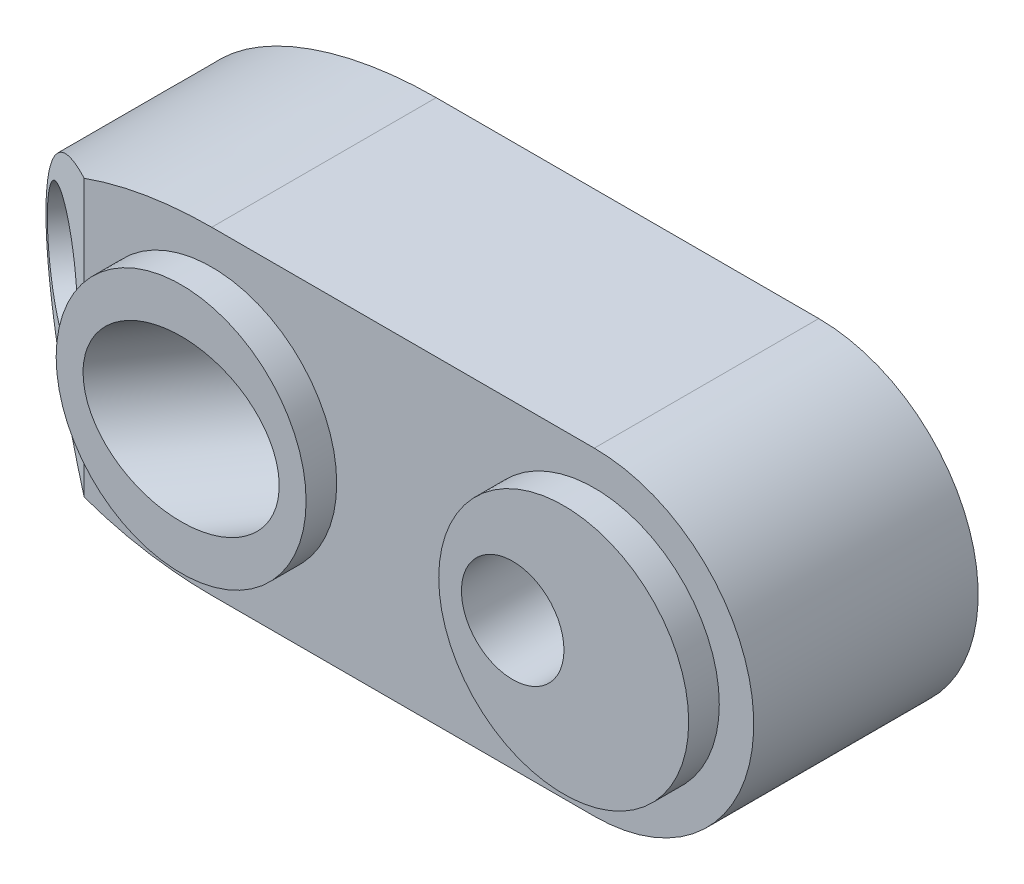
from build123d import *

# Parameters (mm, degrees)
BOSS_EXTRUDE1_DEPTH     = 12.7
SKETCH2_OUTSIDE_W       = 50.606
SKETCH2_OUTSIDE_H       = 26.794
SKETCH2_OUTSIDE_R       = 6.223
CUT_EXTRUDE1_DEPTH      = 1.524
CUT_EXTRUDE2_DEPTH      = 31.86452773
CUT_EXTRUDE2_DEPTH_BACK = 31.86452773
SKETCH3_R               = 4
SKETCH5_W               = 11
SKETCH5_H               = 21
CUT_EXTRUDE3_DEPTH      = 26.772703239
CUT_EXTRUDE4_DEPTH      = 31.86452773
CUT_EXTRUDE4_DEPTH_BACK = 31.86452773
F_1_4_20_TAPPED_HOLE1_D = 5.1054


with BuildPart() as part:
    # Sketch1 → Boss-Extrude1 (new body)
    with BuildSketch(Plane.XY):
        with BuildLine():
            Line((0, 7.9375), (19.05, 7.9375))
            ThreePointArc((19.05, 7.9375), (26.9875, 0), (19.05, -7.9375))
            Line((19.05, -7.9375), (0, -7.9375))
            add(Edge.make_bspline(
                [(0, 7.9375), (-12.7, 7.9375), (-12.7, 0), (-12.7, -7.9375), (0, -7.9375)],
                knots=[4.71238898, 4.71238898, 4.71238898, 6.283185307, 6.283185307, 7.853981634, 7.853981634, 7.853981634], degree=2, weights=[1, 0.707106781, 1, 0.707106781, 1]))
        make_face()
    extrude(amount=-BOSS_EXTRUDE1_DEPTH)

    # Sketch2 outside → Cut-Extrude1 (cut)
    with BuildSketch(Plane.XY):
        with Locations((7.144, 0)):
            Rectangle(SKETCH2_OUTSIDE_W, SKETCH2_OUTSIDE_H)
        Circle(SKETCH2_OUTSIDE_R, mode=Mode.SUBTRACT)
        with Locations((19.05, 0)):
            Circle(SKETCH2_OUTSIDE_R, mode=Mode.SUBTRACT)
    extrude(amount=-CUT_EXTRUDE1_DEPTH, mode=Mode.SUBTRACT)

    # Sketch3 → Cut-Extrude2 (cut, two sides: drawn at the far end of the back side and taken through both)
    with BuildSketch(Plane(origin=(0, 0, 0), x_dir=(0, -1, 0), z_dir=(-0.5735764363510473, 0, 0.819152044288991)).offset(-CUT_EXTRUDE2_DEPTH_BACK)):
        Circle(SKETCH3_R)
    extrude(amount=CUT_EXTRUDE2_DEPTH + CUT_EXTRUDE2_DEPTH_BACK, mode=Mode.SUBTRACT)

    # Sketch5 → Cut-Extrude3 (cut, through all)
    with BuildSketch(Plane(origin=(3.642210371, 0, -5.201615481), x_dir=(0, -1, 0), z_dir=(-0.5735764363510473, 0, 0.819152044288991))):
        with Locations((0, -5)):
            Rectangle(SKETCH5_W, SKETCH5_H)
    extrude(amount=-CUT_EXTRUDE3_DEPTH, mode=Mode.SUBTRACT)

    # Sketch8 → Cut-Extrude4 (cut, two sides: drawn at the far end of the back side and taken through both)
    with BuildSketch(Plane(origin=(0, 0, 0), x_dir=(1, 0, 0), z_dir=(0, 1, 0)).offset(-CUT_EXTRUDE4_DEPTH_BACK)):
        Polygon((-12.7, 5.970317868), (-6.35, 1.524), (-8.439086045, -1.459524071), (-14.789086045, 2.986793797), align=None)
    extrude(amount=CUT_EXTRUDE4_DEPTH + CUT_EXTRUDE4_DEPTH_BACK, mode=Mode.SUBTRACT)

    # Sketch4 → Cut-Revolve1 (revolve, cut)
    with BuildSketch(Plane(origin=(0, 0, 0), x_dir=(1, 0, 0), z_dir=(0, 1, 0))):
        Polygon((-3.1604065, 13.792663111), (-9.974152582, 4.061625224), (-12.470928013, 5.809886202), (-10.369429822, 8.811136656), (-9.433139035, 8.155538789), (-4.720891144, 14.885326222), align=None)
    revolve(axis=Axis((-9.974152582, 0, -4.061625224), (-0.5735764363510472, 0, 0.8191520442889911)), mode=Mode.SUBTRACT)

    # 1/4-20 Tapped Hole1 (through all)
    with Locations(Plane.XY):
        with Locations((16.51, 0)):
            Hole(F_1_4_20_TAPPED_HOLE1_D / 2)


solid = part.part
